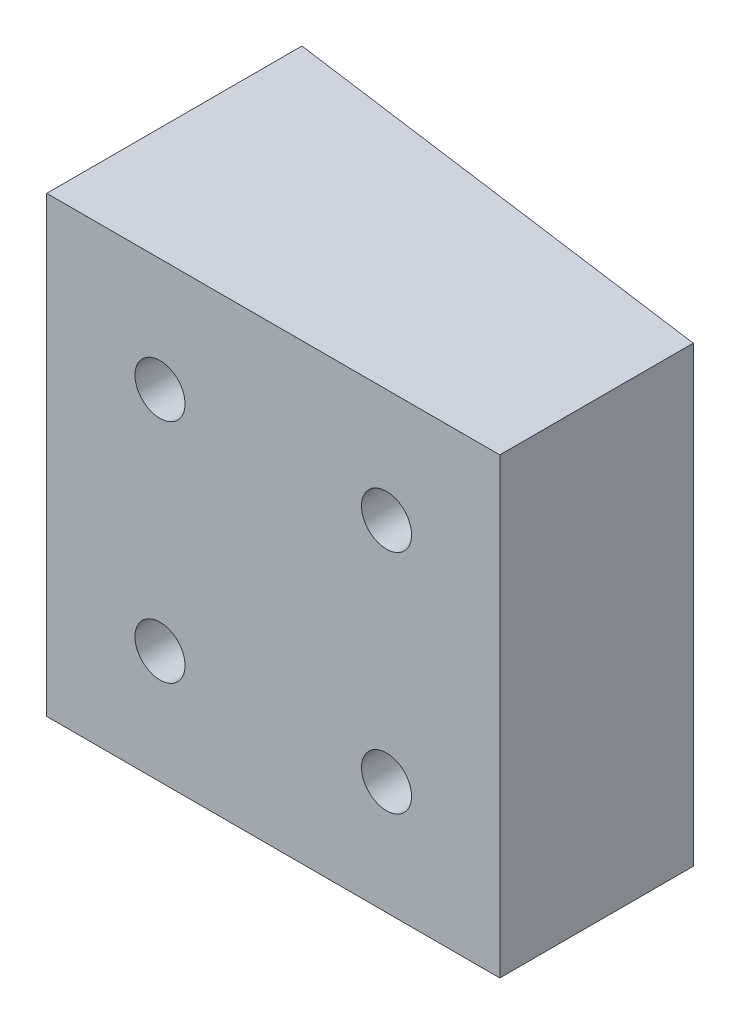
from build123d import *

# Parameters (mm, degrees)
BOSS_EXTRUDE1_DEPTH                                = 50.8
CSK_FOR_10_FLAT_HEAD_MACHINE_SCREW_100_D           = 5.6134
CSK_FOR_10_FLAT_HEAD_MACHINE_SCREW_100_CSINK_D     = 17.78
CSK_FOR_10_FLAT_HEAD_MACHINE_SCREW_100_CSINK_ANGLE = 90
CSK_FOR_10_FLAT_HEAD_MACHINE_SCREW_2_D             = 5.6134
CSK_FOR_10_FLAT_HEAD_MACHINE_SCREW_2_CSINK_D       = 17.78
CSK_FOR_10_FLAT_HEAD_MACHINE_SCREW_2_CSINK_ANGLE   = 90


with BuildPart() as part:
    # Sketch1 → Boss-Extrude1 (new body)
    with BuildSketch(Plane(origin=(0, 0, 0), x_dir=(1, 0, 0), z_dir=(0, 1, 0))):
        Polygon((0, 0), (50.8, 0), (50.8, 21.69437447), (0, 28.609796644), align=None)
    extrude(amount=BOSS_EXTRUDE1_DEPTH)

    # CSK for _10 Flat Head Machine Screw _100 (through all)
    with Locations(Plane(origin=(320.741972913, -316.395089466, -35.56), x_dir=(1, 0, 0), z_dir=(0, 0, -1))):
        with Locations((-308.041854918, -227.495089466), (-308.041854918, -252.895089466), (-308.041972913, -329.095089466), (-308.041972913, -354.495089466)):
            CounterSinkHole(CSK_FOR_10_FLAT_HEAD_MACHINE_SCREW_100_D / 2, CSK_FOR_10_FLAT_HEAD_MACHINE_SCREW_100_CSINK_D / 2, counter_sink_angle=CSK_FOR_10_FLAT_HEAD_MACHINE_SCREW_100_CSINK_ANGLE)

    # CSK for _10 Flat Head Machine Screw  2 (through all)
    with Locations(Plane(origin=(320.741972913, -316.395089466, -33.02), x_dir=(1, 0, 0), z_dir=(0, 0, -1))):
        with Locations((-282.641854918, -227.495089466), (-282.641854918, -252.895089466), (-282.641972913, -329.095089466), (-282.641972913, -354.495089466)):
            CounterSinkHole(CSK_FOR_10_FLAT_HEAD_MACHINE_SCREW_2_D / 2, CSK_FOR_10_FLAT_HEAD_MACHINE_SCREW_2_CSINK_D / 2, counter_sink_angle=CSK_FOR_10_FLAT_HEAD_MACHINE_SCREW_2_CSINK_ANGLE)


solid = part.part
